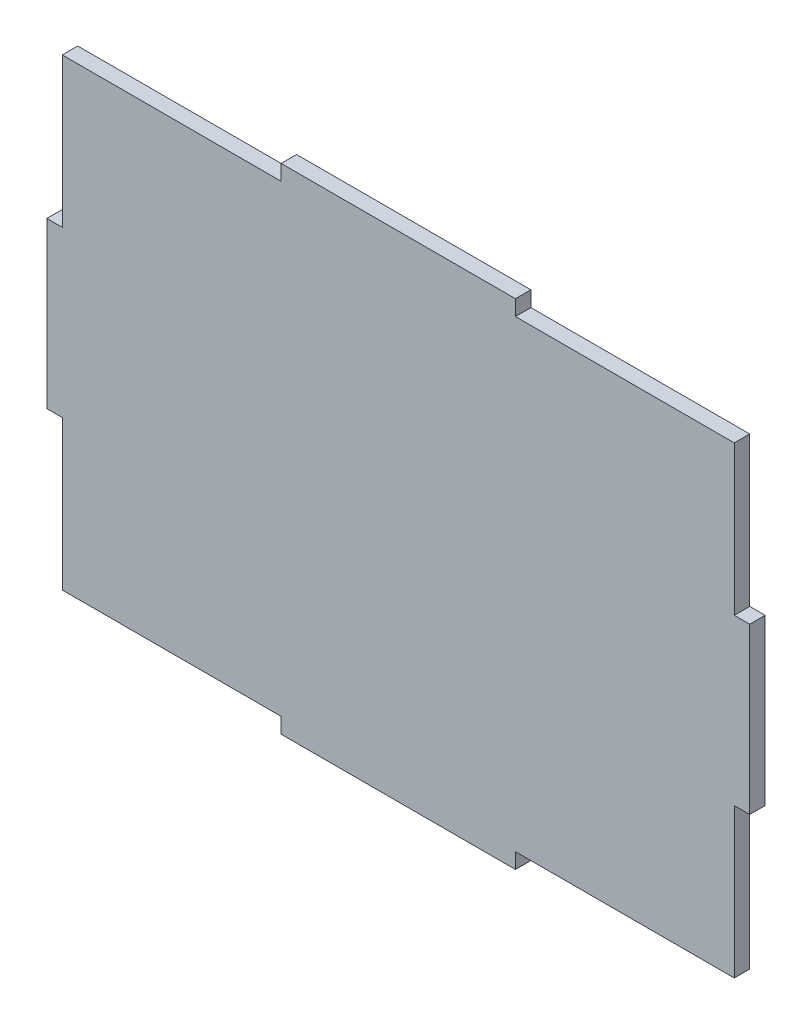
from build123d import *

# Parameters (mm, degrees)
SKETCH1_W           = 231.14
SKETCH1_H           = 162.56
BOSS_EXTRUDE1_DEPTH = 5.08
CAVITY1_START       = -115.57
CAVITY1_OUTLINE_W   = 5.08
CAVITY1_OUTLINE_H   = 5.08
CAVITY1_DEPTH       = 77.046666667
CAVITY1_START_2     = 38.523333333
CAVITY1_2_OUTLINE_W = 5.08
CAVITY1_2_OUTLINE_H = 5.08
CAVITY1_2_DEPTH     = 77.046666667
CAVITY1_3_OUTLINE_W = 49.106666667
CAVITY1_3_OUTLINE_H = 5.08
CAVITY1_3_DEPTH     = 5.08
CAVITY1_START_3     = 110.49
CAVITY1_4_OUTLINE_W = 49.106666667
CAVITY1_4_OUTLINE_H = 5.08
CAVITY1_4_DEPTH     = 5.08


# Read off the part's stored shape, not the designer's step: Cavity1
with BuildPart() as part:
    # Sketch1 → Boss-Extrude1 (new body)
    with BuildSketch(Plane.XY):
        Rectangle(SKETCH1_W, SKETCH1_H)
    extrude(amount=BOSS_EXTRUDE1_DEPTH)

    # Cavity1 outline → Cavity1 (cut)
    with BuildSketch(Plane.YZ.offset(CAVITY1_START)):
        with Locations((78.74, 2.54)):
            Rectangle(CAVITY1_OUTLINE_W, CAVITY1_OUTLINE_H)
        with Locations((-78.74, 2.54)):
            Rectangle(CAVITY1_OUTLINE_W, CAVITY1_OUTLINE_H)
    extrude(amount=CAVITY1_DEPTH, mode=Mode.SUBTRACT)

    # Cavity1 2 outline → Cavity1 2 (cut)
    with BuildSketch(Plane.YZ.offset(CAVITY1_START_2)):
        with Locations((78.74, 2.54)):
            Rectangle(CAVITY1_2_OUTLINE_W, CAVITY1_2_OUTLINE_H)
        with Locations((-78.74, 2.54)):
            Rectangle(CAVITY1_2_OUTLINE_W, CAVITY1_2_OUTLINE_H)
    extrude(amount=CAVITY1_2_DEPTH, mode=Mode.SUBTRACT)

    # Cavity1 3 outline → Cavity1 3 (cut)
    with BuildSketch(Plane.YZ.offset(CAVITY1_START)):
        with Locations((51.646666667, 2.54)):
            Rectangle(CAVITY1_3_OUTLINE_W, CAVITY1_3_OUTLINE_H)
        with Locations((-51.646666667, 2.54)):
            Rectangle(CAVITY1_3_OUTLINE_W, CAVITY1_3_OUTLINE_H)
    extrude(amount=CAVITY1_3_DEPTH, mode=Mode.SUBTRACT)

    # Cavity1 4 outline → Cavity1 4 (cut)
    with BuildSketch(Plane.YZ.offset(CAVITY1_START_3)):
        with Locations((51.646666667, 2.54)):
            Rectangle(CAVITY1_4_OUTLINE_W, CAVITY1_4_OUTLINE_H)
        with Locations((-51.646666667, 2.54)):
            Rectangle(CAVITY1_4_OUTLINE_W, CAVITY1_4_OUTLINE_H)
    extrude(amount=CAVITY1_4_DEPTH, mode=Mode.SUBTRACT)


solid = part.part
